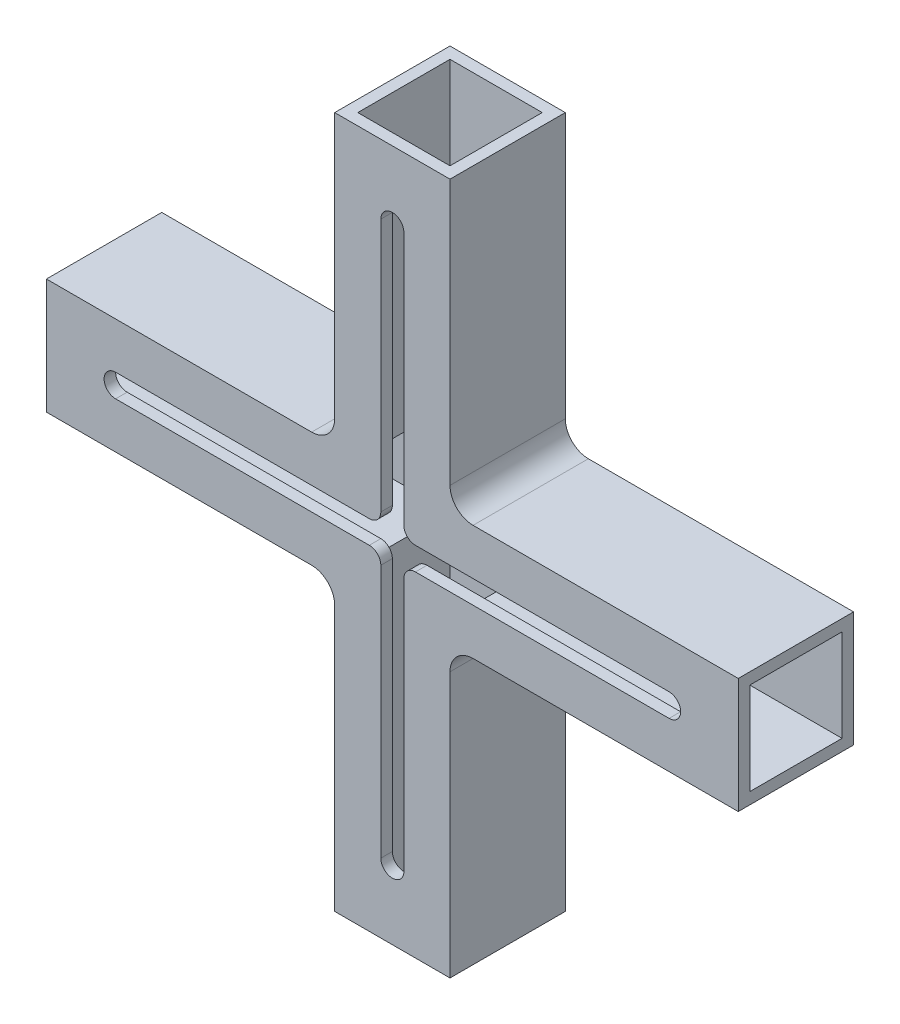
from build123d import *

# Parameters (mm, degrees)
BOSS_EXTRUDE1_DEPTH = 10
SKETCH5_W           = 16
SKETCH5_H           = 16
CUT_EXTRUDE1_DEPTH  = 120
CUT_EXTRUDE2_REACH  = 136.536
SKETCH3_W           = 16
SKETCH3_H           = 16
CUT_EXTRUDE3_DEPTH  = 2
FILLET1_R           = 2
FILLET2_R           = 2
FILLET3_R           = 2
FILLET4_R           = 2


with BuildPart() as part:
    # Sketch2 → Boss-Extrude1 (new, symmetric)
    with BuildSketch(Plane.XY):
        with BuildLine():
            Line((10, 60), (-10, 60))
            Line((-10, 60), (-10, 14))
            ThreePointArc((-10, 14), (-11.171572875, 11.171572875), (-14, 10))
            Line((-14, 10), (-60, 10))
            Line((-60, 10), (-60, -10))
            Line((-60, -10), (-14, -10))
            ThreePointArc((-14, -10), (-11.171572875, -11.171572875), (-10, -14))
            Line((-10, -14), (-10, -60))
            Line((-10, -60), (10, -60))
            Line((10, -60), (10, -14))
            ThreePointArc((10, -14), (11.171572875, -11.171572875), (14, -10))
            Line((14, -10), (60, -10))
            Line((60, -10), (60, 10))
            Line((60, 10), (14, 10))
            ThreePointArc((14, 10), (11.171572875, 11.171572875), (10, 14))
            Line((10, 14), (10, 60))
        make_face()
    extrude(amount=BOSS_EXTRUDE1_DEPTH, both=True)

    # Sketch5 → Cut-Extrude1 (cut)
    with BuildSketch(Plane(origin=(0, 60, 0), x_dir=(1, 0, 0), z_dir=(0, 1, 0))):
        Rectangle(SKETCH5_W, SKETCH5_H)
    extrude(amount=-CUT_EXTRUDE1_DEPTH, mode=Mode.SUBTRACT)

    # Cut-Extrude2: up to this face of the body (flat: up to its plane)
    cut_extrude2_end = Plane(part.part.faces().sort_by_distance((-60, 0, 0))[0])
    # Sketch3 → Cut-Extrude2 (cut, up to the picked face)
    with BuildSketch(Plane(origin=(60, 0, 0), x_dir=(0, 0, -1), z_dir=(1, 0, 0)), mode=Mode.PRIVATE) as cut_extrude2_sk1:
        Rectangle(SKETCH3_W, SKETCH3_H)
    cut_extrude2_tool1 = split(extrude(cut_extrude2_sk1.sketch, amount=-CUT_EXTRUDE2_REACH, mode=Mode.PRIVATE), bisect_by=cut_extrude2_end, keep=Keep.BOTH, mode=Mode.PRIVATE)
    add(cut_extrude2_tool1.solids().sort_by(Axis((60, 0, 0), (-1, 0, 0)))[0], mode=Mode.SUBTRACT)

    # Sketch6 → Cut-Extrude3 (cut)
    with BuildSketch(Plane.XY.offset(10)):
        with BuildLine():
            Line((-2, 4), (-2, 50))
            Line((-2, 50), (2, 50))
            Line((2, 50), (2, 4))
            ThreePointArc((2, 4), (2.585786438, 2.585786438), (4, 2))
            Line((4, 2), (50, 2))
            Line((50, 2), (50, -2))
            Line((50, -2), (4, -2))
            ThreePointArc((4, -2), (2.585786438, -2.585786438), (2, -4))
            Line((2, -4), (2, -50))
            Line((2, -50), (-2, -50))
            Line((-2, -50), (-2, -4))
            ThreePointArc((-2, -4), (-2.585786438, -2.585786438), (-4, -2))
            Line((-4, -2), (-50, -2))
            Line((-50, -2), (-50, 2))
            Line((-50, 2), (-4, 2))
            ThreePointArc((-4, 2), (-2.585786438, 2.585786438), (-2, 4))
        make_face()
    extrude(amount=-CUT_EXTRUDE3_DEPTH, mode=Mode.SUBTRACT)

    # Fillet1
    fillet1_edges = [part.edges().sort_by_distance(p)[0] for p in [
        (-2, 50, 9),
        (2, 50, 9),
    ]]
    fillet(fillet1_edges, radius=FILLET1_R - 0.0001)  # a hair under: the kernel refuses the full size

    # Fillet2
    fillet2_edges = [part.edges().sort_by_distance(p)[0] for p in [
        (2, -50, 9),
        (-2, -50, 9),
    ]]
    fillet(fillet2_edges, radius=FILLET2_R - 0.0001)  # a hair under: the kernel refuses the full size

    # Fillet3
    fillet3_edges = [part.edges().sort_by_distance(p)[0] for p in [
        (50, 2, 9),
        (50, -2, 9),
    ]]
    fillet(fillet3_edges, radius=FILLET3_R - 0.0001)  # a hair under: the kernel refuses the full size

    # Fillet4
    fillet4_edges = [part.edges().sort_by_distance(p)[0] for p in [
        (-50, -2, 9),
        (-50, 2, 9),
    ]]
    fillet(fillet4_edges, radius=FILLET4_R - 0.0001)  # a hair under: the kernel refuses the full size


solid = part.part
